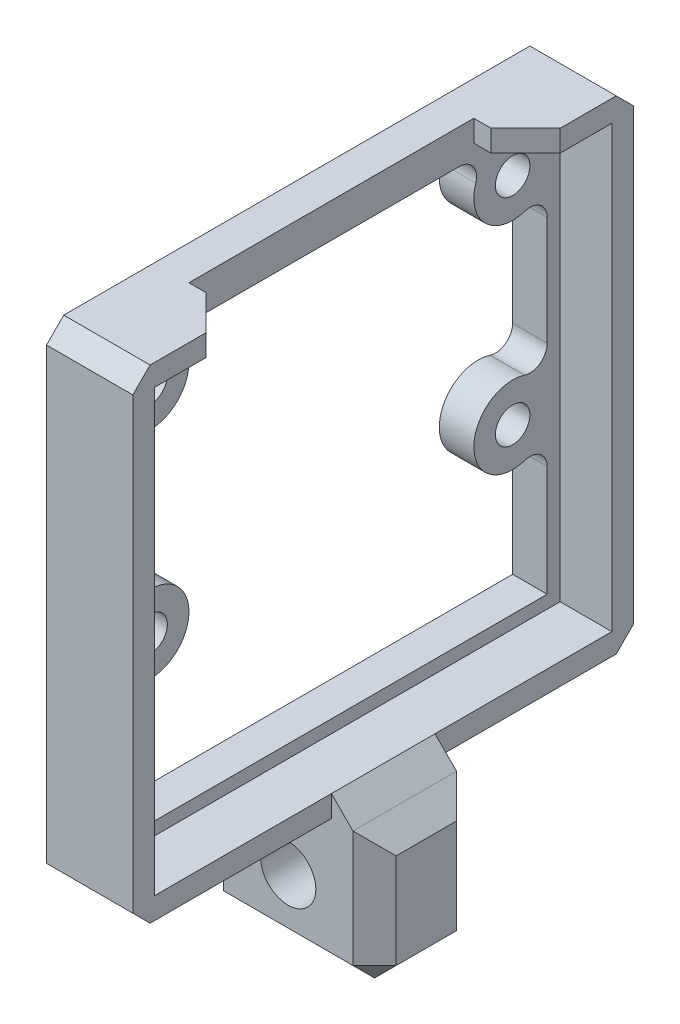
from build123d import *

# Parameters (mm, degrees)
SKETCH1_W                = 29
SKETCH1_H                = 28
SKETCH1_R                = 1
BOSS_EXTRUDE1_DEPTH      = 2
SKETCH2_W                = 29
SKETCH2_H                = 28
SKETCH2_W_2              = 26.5
SKETCH2_H_2              = 25.5
BOSS_EXTRUDE2_DEPTH      = 3
FILLET1_R                = 1
BOSS_EXTRUDE3_DEPTH      = 2.5
BOSS_EXTRUDE3_DEPTH_BACK = 7.5
SKETCH3_W                = 6
SKETCH3_H                = 8
CHAMFER1_SIZE            = 1.25
CUT_EXTRUDE1_DEPTH       = 32.990000884
CUT_EXTRUDE1_DEPTH_BACK  = 32.990000884
SKETCH5_R                = 1.6
SKETCH7_W                = 3
SKETCH7_H                = 16.5
CUT_EXTRUDE2_DEPTH       = 39.40215359
CHAMFER2_SIZE            = 2
CHAMFER3_SIZE            = 1


with BuildPart() as part:
    # Sketch1 → Boss-Extrude1 (new body)
    with BuildSketch(Plane(origin=(0, 0, 0), x_dir=(0, 0, -1), z_dir=(1, 0, 0))):
        with Locations((-0.022840642, -3.707200481)):
            Rectangle(SKETCH1_W, SKETCH1_H)
        with BuildLine():
            ThreePointArc((-12.522840642, 5.262023113), (-8.931850385, 4.701809261), (-9.492064236, 8.292799519))
            Line((-9.492064236, 8.292799519), (9.446382951, 8.292799519))
            ThreePointArc((9.446382951, 8.292799519), (8.8861691, 4.701809261), (12.477159358, 5.262023113))
            Line((12.477159358, 5.262023113), (12.477159358, -5.176424074))
            ThreePointArc((12.477159358, -5.176424074), (8.227159358, -6.207200481), (12.477159358, -7.237976887))
            Line((12.477159358, -7.237976887), (12.477159358, -15.707200481))
            Line((12.477159358, -15.707200481), (-12.522840642, -15.707200481))
            Line((-12.522840642, -15.707200481), (-12.522840642, -7.237976887))
            ThreePointArc((-12.522840642, -7.237976887), (-8.272840642, -6.207200481), (-12.522840642, -5.176424074))
            Line((-12.522840642, -5.176424074), (-12.522840642, 5.262023113))
        make_face(mode=Mode.SUBTRACT)
        with Locations((-10.522840642, 6.292799519)):
            Circle(SKETCH1_R, mode=Mode.SUBTRACT)
        with Locations((-10.522840642, -6.207200481)):
            Circle(SKETCH1_R, mode=Mode.SUBTRACT)
        with Locations((10.477159358, -6.207200481)):
            Circle(SKETCH1_R, mode=Mode.SUBTRACT)
        with Locations((10.477159358, 6.292799519)):
            Circle(SKETCH1_R, mode=Mode.SUBTRACT)
    extrude(amount=BOSS_EXTRUDE1_DEPTH)

    # Sketch2 → Boss-Extrude2 (add)
    with BuildSketch(Plane(origin=(2, 0, 0), x_dir=(0, 0, -1), z_dir=(1, 0, 0))):
        with Locations((-0.022840642, -3.707200481)):
            Rectangle(SKETCH2_W, SKETCH2_H)
        with Locations((-0.022840642, -3.707200481)):
            Rectangle(SKETCH2_W_2, SKETCH2_H_2, mode=Mode.SUBTRACT)
    extrude(amount=BOSS_EXTRUDE2_DEPTH)

    # Fillet1
    fillet1_edges = [part.edges().sort_by_distance(p)[0] for p in [
        (1, 5.262023113, 12.522840642),
        (1, -5.176424074, 12.522840642),
        (1, -7.237976887, 12.522840642),
        (1, -7.237976887, -12.477159358),
        (1, -5.176424074, -12.477159358),
        (1, 5.262023113, -12.477159358),
        (1, 8.292799519, -9.446382951),
        (1, 8.292799519, 9.492064236),
    ]]
    fillet(fillet1_edges, radius=FILLET1_R)

    # Sketch3 → Boss-Extrude3 (add, two sides: drawn at the far end of the back side and taken through both)
    with BuildSketch(Plane.ZY.offset(-BOSS_EXTRUDE3_DEPTH_BACK)):
        with Locations((0.022840642, -21.707200481)):
            Rectangle(SKETCH3_W, SKETCH3_H)
    extrude(amount=BOSS_EXTRUDE3_DEPTH + BOSS_EXTRUDE3_DEPTH_BACK)

    # Chamfer1
    chamfer1_edges = [part.edges().sort_by_distance(p)[0] for p in [
        (2.5, -25.707200481, -2.977159358),
        (-2.5, -17.707200481, 0.022840642),
        (-2.5, -21.707200481, 3.022840642),
        (-2.5, -21.707200481, -2.977159358),
        (-2.5, -25.707200481, 0.022840642),
        (2.5, -25.707200481, 3.022840642),
        (7.5, -25.707200481, 0.022840642),
        (7.5, -21.707200481, 3.022840642),
        (7.5, -17.707200481, 0.022840642),
        (7.5, -21.707200481, -2.977159358),
        (5, -17.707200481, 0.022840642),
        (0, -17.707200481, 0.022840642),
    ]]
    chamfer(chamfer1_edges, length=CHAMFER1_SIZE - 0.0001)  # a hair under: the kernel refuses the full size

    # Sketch5 → Cut-Extrude1 (cut, two sides: drawn at the far end of the back side and taken through both)
    with BuildSketch(Plane(origin=(0, 0, -2.977159358), x_dir=(-1, 0, 0), z_dir=(0, 0, -1)).offset(-CUT_EXTRUDE1_DEPTH_BACK)):
        with Locations(Location((-2.5, -21.707200481, 0), (0, 0, 90))):
            Circle(SKETCH5_R)
    extrude(amount=CUT_EXTRUDE1_DEPTH + CUT_EXTRUDE1_DEPTH_BACK, mode=Mode.SUBTRACT)

    # Sketch7 → Cut-Extrude2 (cut, through all)
    with BuildSketch(Plane.XZ.offset(-9.042799519)):
        with Locations((3.5, 0.022840642)):
            Rectangle(SKETCH7_W, SKETCH7_H)
    extrude(amount=-CUT_EXTRUDE2_DEPTH, mode=Mode.SUBTRACT)

    # Chamfer2
    chamfer2_edges = [part.edges().sort_by_distance(p)[0] for p in [
        (5, 9.667799519, 8.272840642),
        (5, 9.667799519, -8.227159358),
    ]]
    chamfer(chamfer2_edges, length=CHAMFER2_SIZE)

    # Chamfer3
    chamfer3_edges = [part.edges().sort_by_distance(p)[0] for p in [
        (2.5, 10.292799519, -14.477159358),
        (2.5, -17.707200481, -14.477159358),
        (2.5, -17.707200481, 14.522840642),
        (2.5, 10.292799519, 14.522840642),
    ]]
    chamfer(chamfer3_edges, length=CHAMFER3_SIZE)


solid = part.part
